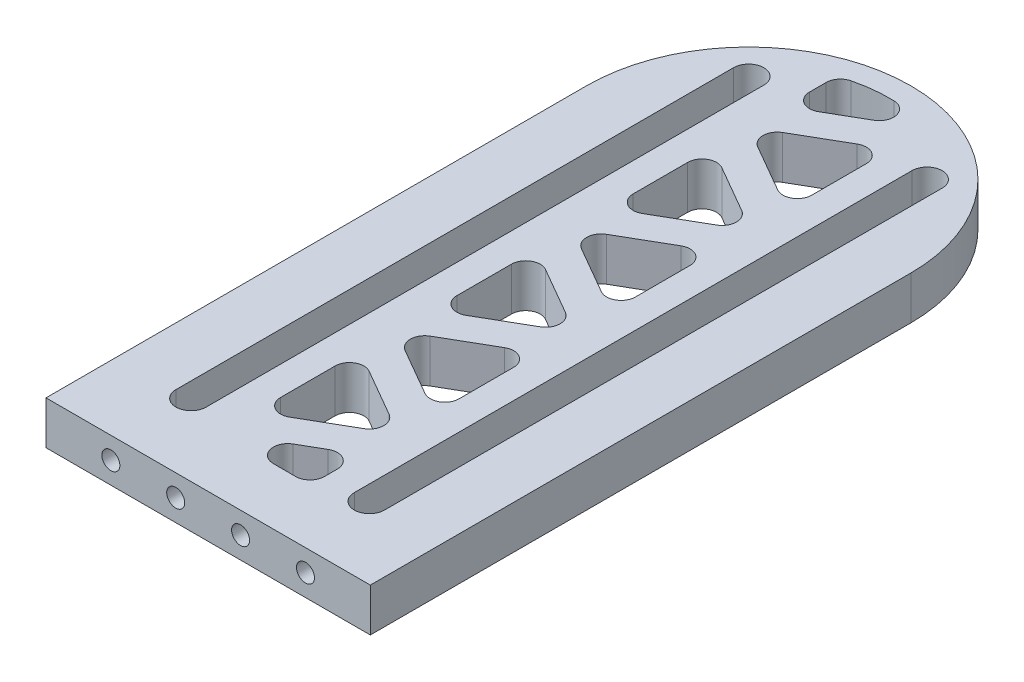
from build123d import *

# Parameters (mm, degrees)
EXTRUDE_1_DEPTH     = 6
CUT_EXTRUDE_1_DEPTH = 79.531840676
CUT_EXTRUDE_2_DEPTH = 79.531840676
FILLET_1_R          = 2
M3X0_51_D           = 2.5
M3X0_51_DEPTH       = 8.5
M3X0_51_TIP         = 0.751075774


with BuildPart() as part:
    # Эскиз1 → Бобышка-Вытянуть1 (new body)
    with BuildSketch(Plane(origin=(0, 0, 0), x_dir=(1, 0, 0), z_dir=(0, 1, 0))):
        with BuildLine():
            Line((-22.5, 0), (-22.5, -75))
            Line((-22.5, -75), (22.5, -75))
            Line((22.5, -75), (22.5, 0))
            ThreePointArc((22.5, 0), (0, 22.5), (-22.5, 0))
        make_face()
    extrude(amount=EXTRUDE_1_DEPTH)

    # Эскиз2 → Вырез-Вытянуть1 (cut, through all)
    with BuildSketch(Plane(origin=(0, 6, 0), x_dir=(1, 0, 0), z_dir=(0, 1, 0))):
        with BuildLine():
            Line((-10.274368671, 12.374368671), (-10.274368671, -65))
            ThreePointArc((-10.274368671, -65), (-12.374368671, -67.1), (-14.474368671, -65))
            Line((-14.474368671, -65), (-14.474368671, 12.374368671))
            ThreePointArc((-14.474368671, 12.374368671), (-12.374368671, 14.474368671), (-10.274368671, 12.374368671))
        make_face()
        with BuildLine():
            Line((10.274368671, 12.374368671), (10.274368671, -65))
            ThreePointArc((10.274368671, -65), (12.374368671, -67.1), (14.474368671, -65))
            Line((14.474368671, -65), (14.474368671, 12.374368671))
            ThreePointArc((14.474368671, 12.374368671), (12.374368671, 14.474368671), (10.274368671, 12.374368671))
        make_face()
    extrude(amount=-CUT_EXTRUDE_1_DEPTH, mode=Mode.SUBTRACT)

    # Эскиз11 → Вырез-Вытянуть2 (cut, through all)
    with BuildSketch(Plane(origin=(0, 6, 0), x_dir=(1, 0, 0), z_dir=(0, 1, 0))):
        with BuildLine():
            Line((6.274368671, 18.5), (-6.274368671, 11.254983118))
            Line((-6.274368671, 11.254983118), (-6.274368671, 18.5))
            ThreePointArc((-6.274368671, 18.5), (0, 19.535037809), (6.274368671, 18.5))
        make_face()
        Polygon((-6.274368671, 6.266676792), (6.274368671, 13.511693674), (6.274368671, -0.97834009), align=None)
        Polygon((-6.274368671, 1.278370466), (6.274368671, -5.966646416), (-6.274368671, -13.211663298), align=None)
        Polygon((-6.274368671, -18.199969624), (6.274368671, -10.954952742), (6.274368671, -25.444986506), align=None)
        Polygon((-6.274368671, -23.18827595), (6.274368671, -30.433292832), (-6.274368671, -37.678309714), align=None)
        Polygon((-6.274368671, -42.66661604), (6.274368671, -35.421599157), (6.274368671, -49.911632922), align=None)
        Polygon((-6.274368671, -47.654922365), (6.274368671, -54.899939248), (-6.274368671, -62.14495613), align=None)
        Polygon((-6.274368671, -67.133262455), (6.274368671, -67.133262455), (6.274368671, -59.888245573), align=None)
    extrude(amount=-CUT_EXTRUDE_2_DEPTH, mode=Mode.SUBTRACT)

    # Скругление1
    fillet_1_edges = [part.edges().sort_by_distance(p)[0] for p in [
        (6.274368671, 3, 67.133262455),
        (-6.274368671, 3, 67.133262455),
        (6.274368671, 3, 59.888245573),
        (-6.274368671, 3, 62.14495613),
        (6.274368671, 3, 54.899939248),
        (-6.274368671, 3, 47.654922365),
        (-6.274368671, 3, 42.66661604),
        (6.274368671, 3, 35.421599157),
        (6.274368671, 3, 49.911632922),
        (6.274368671, 3, 25.444986506),
        (6.274368671, 3, 10.954952742),
        (6.274368671, 3, 30.433292832),
        (-6.274368671, 3, 23.18827595),
        (-6.274368671, 3, 37.678309714),
        (-6.274368671, 3, 18.199969624),
        (-6.274368671, 3, 13.211663298),
        (6.274368671, 3, 5.966646416),
        (-6.274368671, 3, -1.278370466),
        (-6.274368671, 3, -6.266676792),
        (6.274368671, 3, 0.97834009),
        (6.274368671, 3, -18.5),
        (-6.274368671, 3, -18.5),
        (-6.274368671, 3, -11.254983118),
        (6.274368671, 3, -13.511693674),
    ]]
    fillet(fillet_1_edges, radius=FILLET_1_R)

    # Отверстие обработанное метчиком M3x0.51
    with Locations(Plane.XY.offset(75)):
        with Locations((-13.5, 3), (-4.5, 3), (4.5, 3), (13.5, 3)):
            Hole(M3X0_51_D / 2, depth=M3X0_51_DEPTH)
            with Locations((0, 0, -(M3X0_51_DEPTH + M3X0_51_TIP / 2))):  # 118° drill point
                Cone(0, M3X0_51_D / 2, M3X0_51_TIP, mode=Mode.SUBTRACT)


solid = part.part
